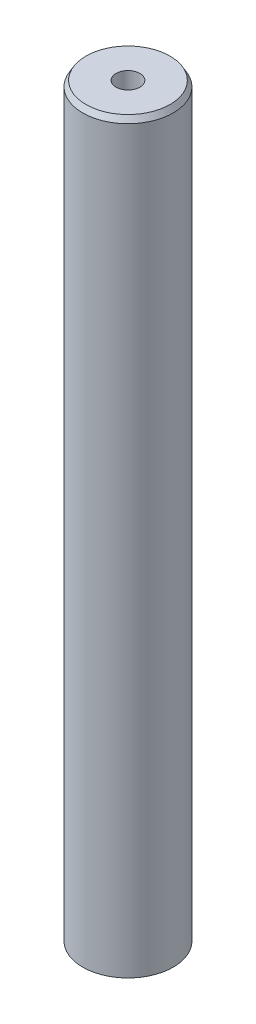
from build123d import *
from OCP.BRepFilletAPI import BRepFilletAPI_MakeChamfer

# Parameters (mm, degrees)
SKETCH1_R           = 7.5
BOSS_EXTRUDE1_DEPTH = 124.066771421
SKETCH2_R           = 1.978596648
CUT_EXTRUDE1_DEPTH  = 125.519330912
CHAMFER1_SIZE       = 0.93533082
CHAMFER1_SIZE2      = 0.540013501


with BuildPart() as part:
    # Sketch1 → Boss-Extrude1 (new body)
    with BuildSketch(Plane(origin=(0, 0, 0), x_dir=(1, 0, 0), z_dir=(0, 1, 0))):
        Circle(SKETCH1_R)
    extrude(amount=BOSS_EXTRUDE1_DEPTH)

    # Sketch2 → Cut-Extrude1 (cut, through all)
    with BuildSketch(Plane(origin=(0, 0, 0), x_dir=(1, 0, 0), z_dir=(0, 1, 0))):
        Circle(SKETCH2_R)
    extrude(amount=CUT_EXTRUDE1_DEPTH, mode=Mode.SUBTRACT)

    # Chamfer1: one chamfer whose edges measure the first distance from different faces: ONE call of the kernel's chamfer builder (chamfer() names one face for all edges)
    chamfer1_edges_1 = [part.edges().sort_by_distance(p)[0] for p in [
        (-7.5, 124.066771421, 0),
    ]]
    chamfer1_side_1 = [part.faces().sort_by_distance(p)[0] for p in [
        (-7.5, 62.03338571, 0),
    ]]
    chamfer1_edges_2 = [part.edges().sort_by_distance(p)[0] for p in [
        (-7.5, 0, 0),
    ]]
    chamfer1_side_2 = [part.faces().sort_by_distance(p)[0] for p in [
        (-7.287867966, 0, 0),
    ]]
    chamfer1 = BRepFilletAPI_MakeChamfer(part.part.solid().wrapped)
    for e in chamfer1_edges_1:
        chamfer1.Add(CHAMFER1_SIZE, CHAMFER1_SIZE2, e.wrapped, chamfer1_side_1[0].wrapped)  # the first distance lies on this face
    for e in chamfer1_edges_2:
        chamfer1.Add(CHAMFER1_SIZE, CHAMFER1_SIZE2, e.wrapped, chamfer1_side_2[0].wrapped)  # the first distance lies on this face
    add(Compound.cast(chamfer1.Shape()), mode=Mode.REPLACE)


solid = part.part
